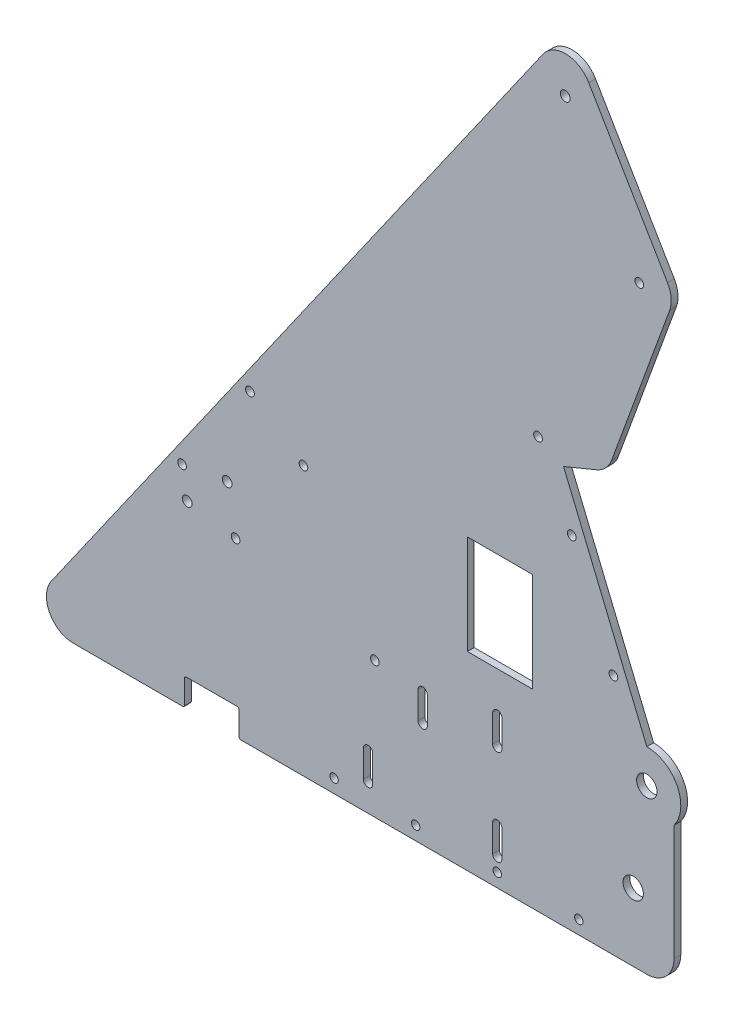
from build123d import *

# Parameters (mm, degrees)
BOSS_EXTRUDE1_DEPTH = 3.175
SKETCH2_R           = 2.286
SKETCH2_R_2         = 2.032
SKETCH2_R_3         = 4.7625
SKETCH2_R_4         = 1.96820932
CUT_EXTRUDE1_DEPTH  = 477.903574071
CUT_EXTRUDE2_DEPTH  = 477.903574071
CUT_EXTRUDE3_REACH  = 478.904
SKETCH10_R          = 2.032
FILLET1_R           = 12.7
FILLET2_R           = 0.79375
CUT_EXTRUDE4_REACH  = 470.735
SKETCH11_W          = 30.48
SKETCH11_H          = 46.355


with BuildPart() as part:
    # Sketch1 → Boss-Extrude1 (new body)
    with BuildSketch(Plane.XY):
        with BuildLine():
            Line((0, 0), (76.2, 0))
            Line((76.2, 0), (76.2, 12.7))
            Line((76.2, 12.7), (101.6, 12.7))
            Line((101.6, 12.7), (101.6, 0))
            Line((101.6, 0), (304.8, 0))
            Line((304.8, 0), (304.8, 66.675))
            ThreePointArc((304.8, 66.675), (306.299031657, 83.299515829), (292.1, 92.075))
            Line((292.1, 92.075), (253.219363272, 185.941160503))
            Line((253.219363272, 185.941160503), (273.752585882, 194.446299787))
            Line((273.752585882, 194.446299787), (304.8, 279.4))
            Line((304.8, 279.4), (254.954725958, 364.113083686))
            Line((254.954725958, 364.113083686), (0, 0))
        make_face()
    extrude(amount=BOSS_EXTRUDE1_DEPTH)

    # Sketch2 → Cut-Extrude1 (cut, through all)
    with BuildSketch(Plane.XY.offset(3.175)):
        with Locations((77.458296873, 84.051783119)):
            Circle(SKETCH2_R)
        with Locations((254, 336.179464547)):
            Circle(SKETCH2_R)
        with Locations((96.115774714, 101.28716883)):
            Circle(SKETCH2_R)
        with Locations((257.072887422, 160.044580582)):
            Circle(SKETCH2_R_2)
        with Locations((292.1, 76.2)):
            Circle(SKETCH2_R_3)
        with Locations((184.15, 6.35)):
            Circle(SKETCH2_R_4)
        with Locations((222.25, 6.35)):
            Circle(SKETCH2_R_4)
        with Locations((260.35, 6.35)):
            Circle(SKETCH2_R_4)
        with Locations((276.513205786, 113.11150033)):
            Circle(SKETCH2_R_2)
        with Locations((288.600184498, 277.926110751)):
            Circle(SKETCH2_R_2)
        with Locations((285.75, 31.75)):
            Circle(SKETCH2_R_3)
        with Locations((106.759933414, 143.058732026)):
            Circle(SKETCH2_R_2)
        with Locations((241.3, 192.0875)):
            Circle(SKETCH2_R_2)
        with Locations((75.072703188, 97.804677339)):
            Circle(SKETCH2_R_2)
        with Locations((100.040457498, 80.322067559)):
            Circle(SKETCH2_R_2)
        with Locations((131.727687724, 125.576122246)):
            Circle(SKETCH2_R_2)
        with Locations((146.05, 6.35)):
            Circle(SKETCH2_R_4)
    extrude(amount=-CUT_EXTRUDE1_DEPTH, mode=Mode.SUBTRACT)

    # Sketch7 → Cut-Extrude2 (cut, through all)
    with BuildSketch(Plane.XY.offset(3.175)):
        with BuildLine():
            Line((220.091, 12.7), (220.091, 25.4))
            ThreePointArc((220.091, 25.4), (222.25, 27.559), (224.409, 25.4))
            Line((224.409, 25.4), (224.409, 12.7))
            ThreePointArc((224.409, 12.7), (222.25, 10.541), (220.091, 12.7))
        make_face()
        with BuildLine():
            Line((220.091, 57.15), (220.091, 69.85))
            ThreePointArc((220.091, 69.85), (222.25, 72.009), (224.409, 69.85))
            Line((224.409, 69.85), (224.409, 57.15))
            ThreePointArc((224.409, 57.15), (222.25, 54.991), (220.091, 57.15))
        make_face()
        with BuildLine():
            Line((185.261472596, 49.111308369), (185.261472596, 61.811308369))
            ThreePointArc((185.261472596, 61.811308369), (187.420472596, 63.970308369), (189.579472596, 61.811308369))
            Line((189.579472596, 61.811308369), (189.579472596, 49.111308369))
            ThreePointArc((189.579472596, 49.111308369), (187.420472596, 46.952308369), (185.261472596, 49.111308369))
        make_face()
        with BuildLine():
            Line((159.766, 12.7), (159.766, 25.4))
            ThreePointArc((159.766, 25.4), (161.925, 27.559), (164.084, 25.4))
            Line((164.084, 25.4), (164.084, 12.7))
            ThreePointArc((164.084, 12.7), (161.925, 10.541), (159.766, 12.7))
        make_face()
    extrude(amount=-CUT_EXTRUDE2_DEPTH, mode=Mode.SUBTRACT)

    # Sketch10 → Cut-Extrude3 (cut, up to next)
    with BuildSketch(Plane.XY.offset(3.175), mode=Mode.PRIVATE) as cut_extrude3_sk1:
        with Locations((165.1, 63.5)):
            Circle(SKETCH10_R)
    cut_extrude3_tool1 = extrude(cut_extrude3_sk1.sketch, amount=-CUT_EXTRUDE3_REACH, mode=Mode.PRIVATE) & part.part
    add(cut_extrude3_tool1.solids().sort_by_distance((165.1, 63.5, 3.175))[0], mode=Mode.SUBTRACT)

    # Fillet1
    fillet1_edges = [part.edges().sort_by_distance(p)[0] for p in [
        (0, 0, 1.5875),
        (304.8, 0, 1.5875),
        (254.954725958, 364.113083686, 1.5875),
        (273.752585882, 194.446299787, 1.5875),
        (304.8, 279.4, 1.5875),
    ]]
    fillet(fillet1_edges, radius=FILLET1_R)

    # Fillet2
    fillet2_edges = [part.edges().sort_by_distance(p)[0] for p in [
        (101.6, 0, 1.5875),
        (101.6, 12.7, 1.5875),
        (76.2, 0, 1.5875),
        (76.2, 12.7, 1.5875),
    ]]
    fillet(fillet2_edges, radius=FILLET2_R)

    # Sketch11 → Cut-Extrude4 (cut, up to next)
    with BuildSketch(Plane.XY.offset(3.175), mode=Mode.PRIVATE) as cut_extrude4_sk1:
        with Locations((223.539981529, 111.845574107)):
            Rectangle(SKETCH11_W, SKETCH11_H)
    cut_extrude4_tool1 = extrude(cut_extrude4_sk1.sketch, amount=-CUT_EXTRUDE4_REACH, mode=Mode.PRIVATE) & part.part
    add(cut_extrude4_tool1.solids().sort_by_distance((223.539982, 111.845574, 3.175))[0], mode=Mode.SUBTRACT)


solid = part.part
